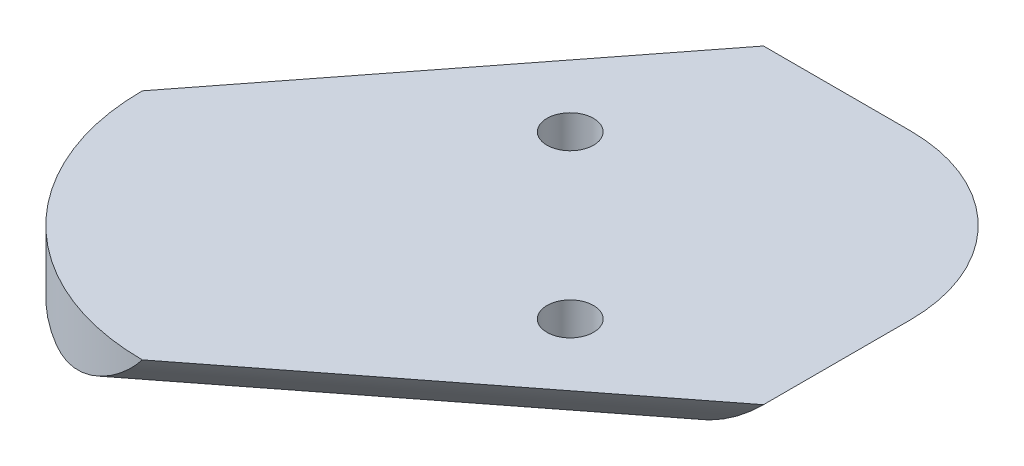
from build123d import *

# Parameters (mm, degrees)
BOSS_EXTRUDE1_DEPTH = 8
FILLET1_R           = 27.432
FILLET3_START       = -62.980474595
FILLET3_DEPTH       = 78.103235199
FILLET3_2_DEPTH     = 78.103235199
SKETCH2_R           = 3
CUT_EXTRUDE1_DEPTH  = 6


with BuildPart() as part:
    # Sketch1 → Boss-Extrude1 (new body)
    with BuildSketch(Plane(origin=(0, 0, 0), x_dir=(1, 0, 0), z_dir=(0, 1, 0))):
        with BuildLine():
            Line((-20, 20), (-55, -25))
            ThreePointArc((-55, -25), (-46.213203436, -46.213203436), (-25, -55))
            Line((-25, -55), (20, -20))
            Line((20, -20), (20, -1.082))
            ThreePointArc((20, -1.082), (13.825225161, 13.825225161), (-1.082, 20))
            Line((-1.082, 20), (-20, 20))
        make_face()
    extrude(amount=BOSS_EXTRUDE1_DEPTH)

    # Fillet1
    # the kernel refuses this fillet: 27.432 mm, written as the material it takes off along each edge
    with BuildSketch(Plane(origin=(-1.082, 0, -20), x_dir=(0, 1, 0), z_dir=(-1, 0, 0)), Plane(origin=(20, 0, 68.406611119), x_dir=(0, 1, 0), z_dir=(0, 0, -1))) as fillet1_piece_1:
        with BuildLine():
            CenterArc((27.432, -19.362644447), FILLET1_R, 135.102431051, 44.897568949)
            Line((0, -19.362644447), (-0.54864, -19.362644447))
            Line((-0.54864, -19.362644447), (-0.54864, 0))
            Line((-0.54864, 0), (0, 0.54864))
            ThreePointArc((0, 0.54864), (4, 0.54864), (7.61136, 0.387252889))
            Line((7.61136, 0.387252889), (8, 0))
        make_face()
    extrude(amount=67.324611119, mode=Mode.SUBTRACT)
    with BuildSketch(Plane(origin=(-1.082, 0, 1.082), x_dir=(1, 0, 0), z_dir=(0, 0, 1))) as fillet1_piece_2:
        with BuildLine():
            CenterArc((1.719355553, 27.432), FILLET1_R, 270, 44.897568949)
            Line((1.719355553, 0), (1.719355553, -0.54864))
            Line((1.719355553, -0.54864), (21.082, -0.54864))
            Line((21.082, -0.54864), (21.63064, 0))
            ThreePointArc((21.63064, 0), (21.63064, 4), (21.469252889, 7.61136))
            Line((21.469252889, 7.61136), (21.082, 8))
        make_face()
    revolve(axis=Axis((-1.082, 0, 1.082), (0, 1, 0)), revolution_arc=90, mode=Mode.SUBTRACT)

    # Fillet3: read off the stored shape, not the designer's step
    # Fillet3 outline → Fillet3 (cut)
    with BuildSketch(Plane(origin=(0, 0, 0), x_dir=(0.7893522173763267, 0, 0.6139406135149199), z_dir=(0.6139406135149199, 0, -0.7893522173763268)).offset(FILLET3_START)):
        with BuildLine():
            ThreePointArc((-28.065856618, -8), (-22.900060751, -2.167840434), (-15.416745977, 0))
            Line((-15.416745977, 0), (-28.065856618, 0))
            Line((-28.065856618, 0), (-28.065856618, -8))
        make_face()
    extrude(amount=FILLET3_DEPTH, mode=Mode.SUBTRACT)

    # Fillet3 2 outline → Fillet3 2 (cut)
    with BuildSketch(Plane(origin=(0, 0, 0), x_dir=(0.6139406135149201, 0, 0.7893522173763264), z_dir=(0.7893522173763264, 0, -0.6139406135149204)).offset(FILLET3_START)):
        with BuildLine():
            Line((28.065856618, 0), (15.416745977, 0))
            ThreePointArc((15.416745977, 0), (22.900060751, -2.167840434), (28.065856618, -8))
            Line((28.065856618, -8), (28.065856618, 0))
        make_face()
    extrude(amount=FILLET3_2_DEPTH, mode=Mode.SUBTRACT)

    # Sketch2 → Cut-Extrude1 (cut)
    with BuildSketch(Plane(origin=(0, 8, 0), x_dir=(1, 0, 0), z_dir=(0, 1, 0))):
        with Locations(Location((-22.88, -2.01, 0), (0, 0, 270))):
            Circle(SKETCH2_R)
        with Locations(Location((-2.01, -22.88, 0), (0, 0, 270))):
            Circle(SKETCH2_R)
    extrude(amount=-CUT_EXTRUDE1_DEPTH, mode=Mode.SUBTRACT)


solid = part.part
